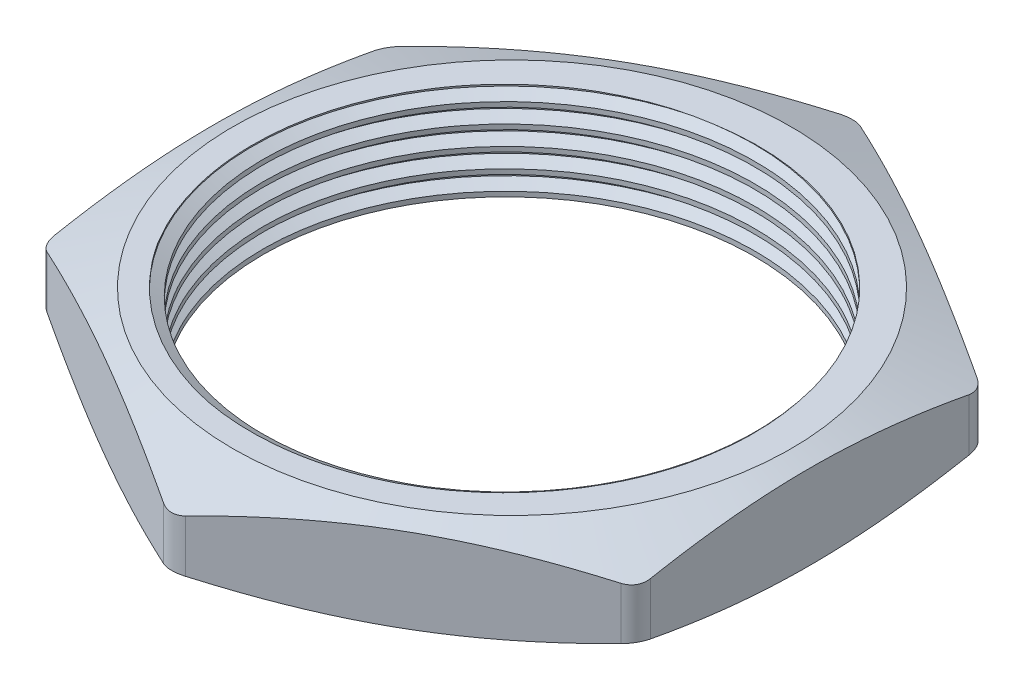
from build123d import *

# Parameters (mm, degrees)
SKETCH_1_R      = 5.7
EXTRUDE_1_DEPTH = 1.15
FILLET_1_R      = 0.5
THREAD_1_PITCH  = 0.45


with BuildPart() as part:
    # Эскиз1 → Бобышка-Вытянуть1 (new, symmetric)
    with BuildSketch(Plane(origin=(0, 0, 0), x_dir=(1, 0, 0), z_dir=(0, 1, 0))):
        Polygon((0, 7.967433715), (-6.9, 3.983716857), (-6.9, -3.983716857), (0, -7.967433715), (6.9, -3.983716857), (6.9, 3.983716857), align=None)
        with Locations(Location((0, 0, 0), (0, 0, 270))):
            Circle(SKETCH_1_R, mode=Mode.SUBTRACT)
    extrude(amount=EXTRUDE_1_DEPTH, both=True)

    # Sketch 2 → Вырез-Повернуть1 (revolve, cut)
    with BuildSketch(Plane(origin=(0, 0, 0), x_dir=(0, 0, -1), z_dir=(1, 0, 0))):
        Polygon((-7.967433715, 0.55), (-7.967433715, 1.15), (-6.467433715, 1.15), align=None)
        Polygon((-7.967433715, -0.55), (-7.967433715, -1.15), (-6.467433715, -1.15), align=None)
    revolve(axis=Axis((0, 7.461835903, 0), (0, -1, 0)), mode=Mode.SUBTRACT)

    # Скругление1
    # the kernel refuses this fillet: 0.5 mm, written as the material it takes off along each edge
    with BuildSketch(Plane(origin=(0, 1.271687836, -7.967433715), x_dir=(-0.8660254037844384, 0, 0.5000000000000006), z_dir=(0, -1, 0)), Plane(origin=(6.9, 1.271687836, -3.983716857), x_dir=(-0.8660254037844419, 0, -0.49999999999999434), z_dir=(0, -1, 0)), Plane(origin=(-6.9, -1.271687836, 3.983716857), x_dir=(0, 0, -1), z_dir=(0, 1, 0)), Plane(origin=(-6.9, -1.271687836, -3.983716857), x_dir=(0.8660254037844378, 0, -0.5000000000000014), z_dir=(0, 1, 0)), Plane(origin=(6.9, 1.271687836, 3.983716857), x_dir=(0, 0, -1), z_dir=(0, -1, 0)), Plane(origin=(0, -1.271687836, 7.967433715), x_dir=(-0.8660254037844429, 0, -0.4999999999999929), z_dir=(0, 1, 0))) as fillet_1_piece_1:
        with BuildLine():
            CenterArc((FILLET_1_R * 0.57735026919, -FILLET_1_R), FILLET_1_R, 90, 60)
            Line((-FILLET_1_R * 0.288675134595, -FILLET_1_R * 0.5), (0, 0))
            Line((0, 0), (FILLET_1_R * 0.57735026919, 0))
        make_face()
    extrude(amount=2.543375673, mode=Mode.SUBTRACT)

    # Резьба1: the profile of Sketch 2 2 profile screwed along a right-hand helix of 8.888889 turns, 6 arcs to a turn; built about Z, then put on its axis
    thread_1_z = Axis((0, 0, 0), (0, 0, 1))
    thread_1_corners = [(5.6997, 0, -0.000173205), (5.943569644, 0, 0.140624999), (5.943569644, 0, 0.196874999), (5.6997, 0, 0.337673204)]
    with BuildLine(mode=Mode.PRIVATE) as thread_1_profile:
        Line(thread_1_corners[0], thread_1_corners[1])
        Line(thread_1_corners[1], thread_1_corners[2])
        Line(thread_1_corners[2], thread_1_corners[3])
        Line(thread_1_corners[3], thread_1_corners[0])
    thread_1_cap = Face(thread_1_profile.wire())
    thread_1_turn_angles = [0, 30, 60, 90, 120, 150, 180, 210, 240, 270, 300, 330, 360]
    thread_1_turn_weights = [1, 0.8660254037844387, 1, 0.8660254037844387, 1, 0.8660254037844387, 1, 0.8660254037844387, 1, 0.8660254037844387, 1, 0.8660254037844387, 1]
    thread_1_turn_rails = [Edge.make_bspline([Vector(p[0], p[1], 0).rotate(thread_1_z, thread_1_turn_angles[k]) / thread_1_turn_weights[k] + Vector(0, 0, p[2] + THREAD_1_PITCH * thread_1_turn_angles[k] / 360) for k in range(13)], [0, 0, 0, 1, 1, 2, 2, 3, 3, 4, 4, 5, 5, 6, 6, 6], 2, thread_1_turn_weights) for p in thread_1_corners]
    thread_1_turn_sides = [Face.make_surface_from_curves(thread_1_turn_rails[p[0]], thread_1_turn_rails[p[1]]) for p in [(0, 1), (1, 2), (2, 3), (3, 0)]]
    thread_1_last_angles = [2880, 2910, 2940, 2970, 3000, 3030, 3060, 3090, 3120, 3150, 3180, 3190, 3200]
    thread_1_last_weights = [1, 0.8660254037844387, 1, 0.8660254037844387, 1, 0.8660254037844387, 1, 0.8660254037844387, 1, 0.8660254037844387, 1, 0.9848077530122074, 1]
    thread_1_last_rails = [Edge.make_bspline([Vector(p[0], p[1], 0).rotate(thread_1_z, thread_1_last_angles[k]) / thread_1_last_weights[k] + Vector(0, 0, p[2] + THREAD_1_PITCH * thread_1_last_angles[k] / 360) for k in range(13)], [0, 0, 0, 1, 1, 2, 2, 3, 3, 4, 4, 5, 5, 6, 6, 6], 2, thread_1_last_weights) for p in thread_1_corners]
    thread_1_last_sides = [Face.make_surface_from_curves(thread_1_last_rails[p[0]], thread_1_last_rails[p[1]]) for p in [(0, 1), (1, 2), (2, 3), (3, 0)]]
    thread_1 = Plane(origin=(0, 2.15, 0), x_dir=(-1, 0, 0), z_dir=(0, -1, 0)) * Solid(Shell([*[p.moved(Location((0, 0, THREAD_1_PITCH * i))) for i in range(8) for p in thread_1_turn_sides], *thread_1_last_sides, thread_1_cap, thread_1_cap.rotate(thread_1_z, 3200).moved(Location((0, 0, THREAD_1_PITCH * 3200 / 360)))]))
    add(thread_1, mode=Mode.SUBTRACT)


solid = part.part
